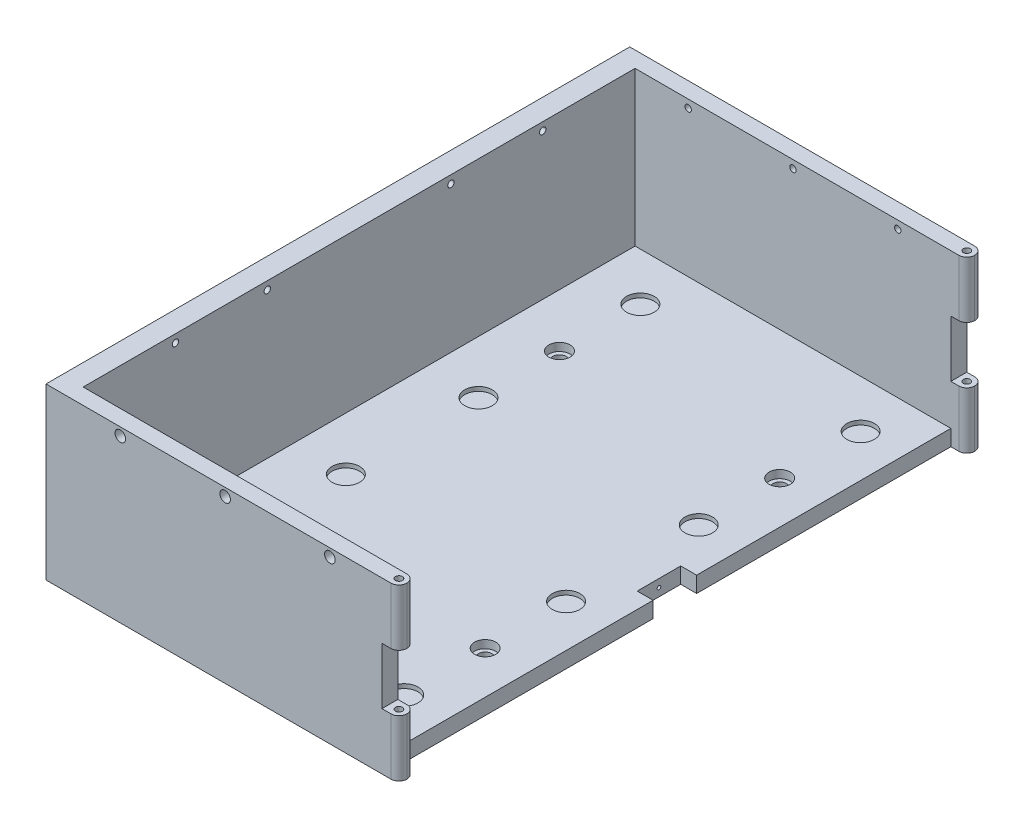
from build123d import *

# Parameters (mm, degrees)
SKETCH_1_W           = 57.5
SKETCH_1_H           = 100
EXTRUDE_1_DEPTH      = 3
SKETCH_2_R           = 2.6
CUT_EXTRUDE_1_DEPTH  = 0.8
SKETCH_3_R           = 1.25
CUT_EXTRUDE_2_DEPTH  = 58.754328842
SKETCH_3_3_R         = 2
CUT_EXTRUDE_3_DEPTH  = 1.5
EXTRUDE_2_DEPTH      = 3
SKETCH_5_3_W         = 57.5
SKETCH_5_3_H         = 3
SKETCH_5_3_W_2       = 2
EXTRUDE_3_DEPTH      = 29
SKETCH_6_W           = 8.2
SKETCH_6_H           = 3
CUT_EXTRUDE_4_DEPTH  = 3
CUT_EXTRUDE_START    = -3
SKETCH_6_4_R         = 0.35
CUT_EXTRUDE_6_DEPTH  = 3
SKETCH_7_W           = 3
SKETCH_7_H           = 10.666666667
EXTRUDE_4_DEPTH      = 3
FILLET_1_R           = 1.5
SKETCH_8_R           = 0.65
CUT_EXTRUDE_7_DEPTH  = 73.50215514
SKETCH_7_3_W         = 3
SKETCH_7_3_H         = 10.666666666
CUT_EXTRUDE_8_DEPTH  = 0.2
SKETCH_10_R          = 0.6
CUT_EXTRUDE_9_DEPTH  = 120.714504134
SKETCH_11_R          = 0.6
CUT_EXTRUDE_10_DEPTH = 93.03939374
SKETCH_12_R          = 1
CUT_EXTRUDE_11_DEPTH = 1.5
CUT_EXTRUDE_START_2  = -108.5
SKETCH_12_2_R        = 1
CUT_EXTRUDE_12_DEPTH = 1.5
SKETCH_13_R          = 1
CUT_EXTRUDE_13_DEPTH = 1.5


with BuildPart() as part:
    # 草图1 → 凸台-拉伸1 (new body)
    with BuildSketch(Plane(origin=(0, 0, 0), x_dir=(1, 0, 0), z_dir=(0, 1, 0))):
        Rectangle(SKETCH_1_W, SKETCH_1_H)
    extrude(amount=EXTRUDE_1_DEPTH)

    # 草图2 → 切除-拉伸1 (cut)
    with BuildSketch(Plane(origin=(0, 3, 0), x_dir=(1, 0, 0), z_dir=(0, 1, 0))):
        with Locations(Location((20.75, 43, 0), (0, 0, 270))):
            Circle(SKETCH_2_R)
        with Locations(Location((20.75, 12.5, 0), (0, 0, 270))):
            Circle(SKETCH_2_R)
        with Locations(Location((-20.75, 12.5, 0), (0, 0, 270))):
            Circle(SKETCH_2_R)
        with Locations(Location((-20.75, 43, 0), (0, 0, 270))):
            Circle(SKETCH_2_R)
    cut_extrude_1 = extrude(amount=-CUT_EXTRUDE_1_DEPTH, mode=Mode.SUBTRACT)

    # 草图3 → 切除-拉伸2 (cut, through all)
    with BuildSketch(Plane(origin=(0, 3, 0), x_dir=(1, 0, 0), z_dir=(0, 1, 0))):
        with Locations(Location((20.75, 27.75, 0), (0, 0, 270))):
            Circle(SKETCH_3_R)
        with Locations(Location((-20.75, 27.75, 0), (0, 0, 270))):
            Circle(SKETCH_3_R)
    cut_extrude_2 = extrude(amount=-CUT_EXTRUDE_2_DEPTH, mode=Mode.SUBTRACT)

    # 草图3<3> → 切除-拉伸3 (cut)
    with BuildSketch(Plane(origin=(0, 3, 0), x_dir=(1, 0, 0), z_dir=(0, 1, 0))):
        with Locations(Location((20.75, 27.75, 0), (0, 0, 270))):
            Circle(SKETCH_3_3_R)
        with Locations(Location((-20.75, 27.75, 0), (0, 0, 270))):
            Circle(SKETCH_3_3_R)
    cut_extrude_3 = extrude(amount=-CUT_EXTRUDE_3_DEPTH, mode=Mode.SUBTRACT)

    # 镜向1: 切除-拉伸1, 切除-拉伸2, 切除-拉伸3 across plane
    add(cut_extrude_1.mirror(Plane.XY), mode=Mode.SUBTRACT)
    add(cut_extrude_2.mirror(Plane.XY), mode=Mode.SUBTRACT)
    add(cut_extrude_3.mirror(Plane.XY), mode=Mode.SUBTRACT)

    # 草图5 → 凸台-拉伸2 (add)
    with BuildSketch(Plane(origin=(0, 3, 0), x_dir=(1, 0, 0), z_dir=(0, 1, 0))):
        Polygon((28.75, -50), (-28.75, -50), (-28.75, 50), (28.75, 50), (28.75, 55), (-34.75, 55), (-34.75, -55), (28.75, -55), align=None)
    extrude(amount=-EXTRUDE_2_DEPTH)

    # 草图5<3> → 凸台-拉伸3 (add)
    with BuildSketch(Plane(origin=(0, 3, 0), x_dir=(1, 0, 0), z_dir=(0, 1, 0))):
        with Locations((0, -53.5)):
            Rectangle(SKETCH_5_3_W, SKETCH_5_3_H)
        with Locations((0, 53.5)):
            Rectangle(SKETCH_5_3_W, SKETCH_5_3_H)
        Polygon((-30.75, -55), (-30.75, -52), (-30.75, 52), (-30.75, 55), (-34.75, 55), (-34.75, -55), align=None)
        with Locations((-29.75, 53.5)):
            Rectangle(SKETCH_5_3_W_2, SKETCH_5_3_H)
        with Locations((-29.75, -53.5)):
            Rectangle(SKETCH_5_3_W_2, SKETCH_5_3_H)
    extrude(amount=EXTRUDE_3_DEPTH)

    # 草图6 → 切除-拉伸4 (cut)
    with BuildSketch(Plane(origin=(28.75, 0, 0), x_dir=(0, 0, -1), z_dir=(1, 0, 0))):
        with Locations((0, 1.5)):
            Rectangle(SKETCH_6_W, SKETCH_6_H)
    extrude(amount=-CUT_EXTRUDE_4_DEPTH, mode=Mode.SUBTRACT)

    # 草图6<4> → 切除-拉伸6 (cut)
    with BuildSketch(Plane(origin=(28.75, 0, 0), x_dir=(0, 0, -1), z_dir=(1, 0, 0)).offset(CUT_EXTRUDE_START)):
        with Locations((0, 1.5)):
            Circle(SKETCH_6_4_R)
    extrude(amount=-CUT_EXTRUDE_6_DEPTH, mode=Mode.SUBTRACT)

    # 草图7 → 凸台-拉伸4 (add)
    with BuildSketch(Plane(origin=(28.75, 0, 0), x_dir=(0, 0, -1), z_dir=(1, 0, 0))):
        with Locations((-53.5, 26.666666666)):
            Rectangle(SKETCH_7_W, SKETCH_7_H)
        Polygon((-52, 10.666666667), (-55, 10.666666667), (-55, 0), (-52, 0), (-52, 3), align=None)
        with Locations((53.5, 26.666666666)):
            Rectangle(SKETCH_7_W, SKETCH_7_H)
        with Locations((53.5, 5.333333334)):
            Rectangle(SKETCH_7_W, SKETCH_7_H)
    extrude(amount=EXTRUDE_4_DEPTH)

    # 圆角1
    # the kernel refuses this fillet: 1.5 mm, written as the material it takes off along each edge
    with BuildSketch(Plane(origin=(31.75, 17.583333333, -55), x_dir=(-1, 0, 0), z_dir=(0, 1, 0)), Plane(origin=(31.75, 35.75, -52), x_dir=(-1, 0, 0), z_dir=(0, -1, 0)), Plane(origin=(31.75, -3.75, -55), x_dir=(-1, 0, 0), z_dir=(0, 1, 0)), Plane(origin=(31.75, 14.416666667, -52), x_dir=(-1, 0, 0), z_dir=(0, -1, 0)), Plane(origin=(31.75, 14.416666667, 55), x_dir=(-1, 0, 0), z_dir=(0, -1, 0)), Plane(origin=(31.75, 17.583333333, 52), x_dir=(-1, 0, 0), z_dir=(0, 1, 0)), Plane(origin=(31.75, 35.75, 55), x_dir=(-1, 0, 0), z_dir=(0, -1, 0))) as fillet_1_piece_1:
        with BuildLine():
            CenterArc((FILLET_1_R, FILLET_1_R), FILLET_1_R, 180, 90)
            Line((0, FILLET_1_R), (0, 0))
            Line((0, 0), (FILLET_1_R, 0))
        make_face()
    extrude(amount=18.166666667, mode=Mode.SUBTRACT)
    with BuildSketch(Plane(origin=(31.75, 14.416666667, 52), x_dir=(-1, 0, 0), z_dir=(0, -1, 0))) as fillet_1_piece_2:
        with BuildLine():
            CenterArc((FILLET_1_R, -FILLET_1_R), FILLET_1_R, 90, 90)
            Line((0, -FILLET_1_R), (0, 0))
            Line((0, 0), (FILLET_1_R, 0))
        make_face()
    extrude(amount=18.166666667, mode=Mode.SUBTRACT)

    # 草图8 → 切除-拉伸7 (cut, through all)
    with BuildSketch(Plane(origin=(0, 32, 0), x_dir=(1, 0, 0), z_dir=(0, 1, 0))):
        with Locations(Location((30.25, -53.5, 0), (0, 0, 270))):
            Circle(SKETCH_8_R)
        with Locations(Location((30.25, 53.5, 0), (0, 0, 270))):
            Circle(SKETCH_8_R)
    extrude(amount=-CUT_EXTRUDE_7_DEPTH, mode=Mode.SUBTRACT)

    # 草图7<3> → 切除-拉伸8 (cut)
    with BuildSketch(Plane(origin=(28.75, 0, 0), x_dir=(0, 0, -1), z_dir=(1, 0, 0))):
        with Locations((-53.5, 16)):
            Rectangle(SKETCH_7_3_W, SKETCH_7_3_H)
    extrude(amount=-CUT_EXTRUDE_8_DEPTH, mode=Mode.SUBTRACT)

    # 草图10 → 切除-拉伸9 (cut, through all)
    with BuildSketch(Plane(origin=(0, 0, -55), x_dir=(-1, 0, 0), z_dir=(0, 0, -1))):
        with Locations((-18.75, 30.5)):
            Circle(SKETCH_10_R)
        with Locations((1, 30.5)):
            Circle(SKETCH_10_R)
        with Locations((20.75, 30.5)):
            Circle(SKETCH_10_R)
    extrude(amount=-CUT_EXTRUDE_9_DEPTH, mode=Mode.SUBTRACT)

    # 草图11 → 切除-拉伸10 (cut, through all)
    with BuildSketch(Plane.ZY.offset(34.75)):
        with Locations((-34.6, 30.5)):
            Circle(SKETCH_11_R)
        with Locations((-17.3, 30.5)):
            Circle(SKETCH_11_R)
        with Locations((17.3, 30.5)):
            Circle(SKETCH_11_R)
        with Locations((34.6, 30.5)):
            Circle(SKETCH_11_R)
    extrude(amount=-CUT_EXTRUDE_10_DEPTH, mode=Mode.SUBTRACT)

    # 草图12 → 切除-拉伸11 (cut)
    with BuildSketch(Plane(origin=(0, 0, -55), x_dir=(-1, 0, 0), z_dir=(0, 0, -1))):
        with Locations((-18.75, 30.5)):
            Circle(SKETCH_12_R)
        with Locations((1, 30.5)):
            Circle(SKETCH_12_R)
        with Locations((20.75, 30.5)):
            Circle(SKETCH_12_R)
    extrude(amount=-CUT_EXTRUDE_11_DEPTH, mode=Mode.SUBTRACT)

    # 草图12<2> → 切除-拉伸12 (cut)
    with BuildSketch(Plane(origin=(0, 0, -55), x_dir=(-1, 0, 0), z_dir=(0, 0, -1)).offset(CUT_EXTRUDE_START_2)):
        with Locations((-18.75, 30.5)):
            Circle(SKETCH_12_2_R)
        with Locations((1, 30.5)):
            Circle(SKETCH_12_2_R)
        with Locations((20.75, 30.5)):
            Circle(SKETCH_12_2_R)
    extrude(amount=-CUT_EXTRUDE_12_DEPTH, mode=Mode.SUBTRACT)

    # 草图13 → 切除-拉伸13 (cut)
    with BuildSketch(Plane.ZY.offset(34.75)):
        with Locations((-34.6, 30.5)):
            Circle(SKETCH_13_R)
        with Locations((-17.3, 30.5)):
            Circle(SKETCH_13_R)
        with Locations((17.3, 30.5)):
            Circle(SKETCH_13_R)
        with Locations((34.6, 30.5)):
            Circle(SKETCH_13_R)
    extrude(amount=-CUT_EXTRUDE_13_DEPTH, mode=Mode.SUBTRACT)


solid = part.part
